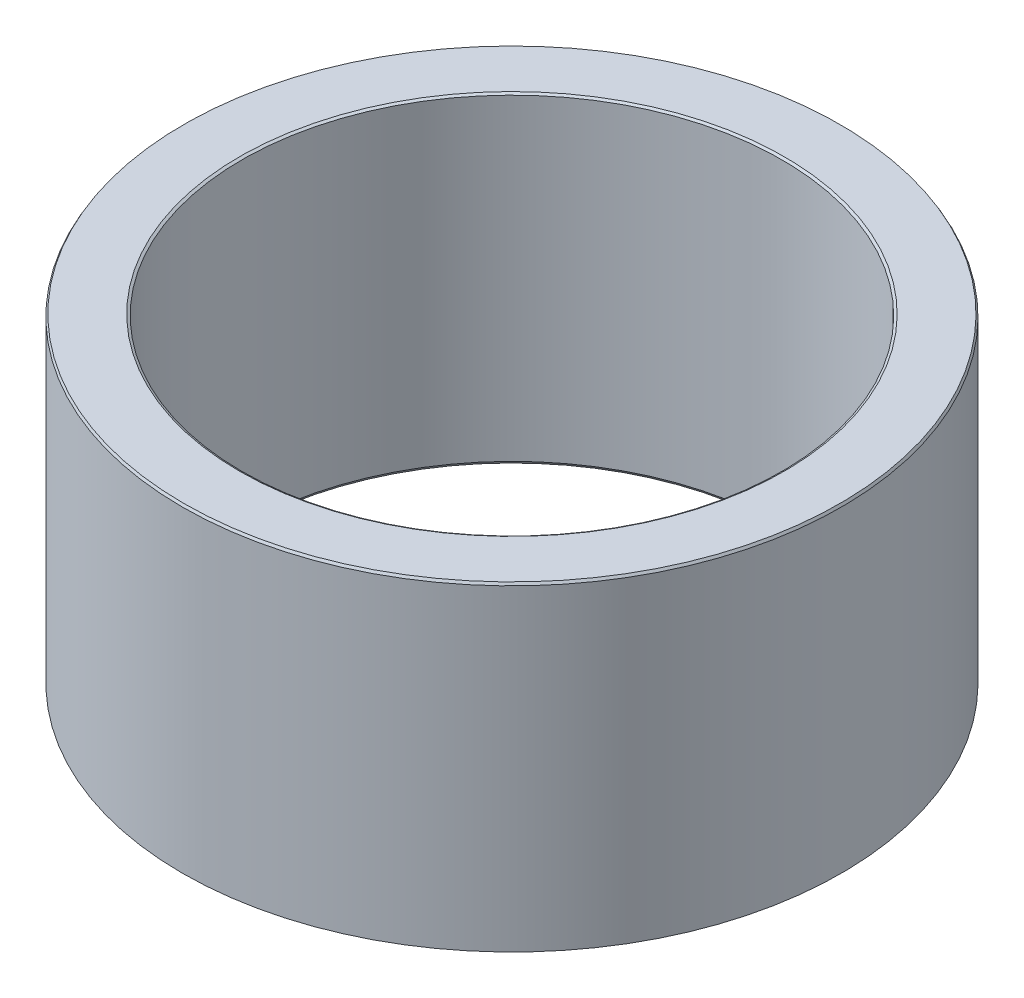
from build123d import *
from OCP.BRepFilletAPI import BRepFilletAPI_MakeChamfer

# Parameters (mm, degrees)
SKETCH1_R           = 30
BOSS_EXTRUDE1_DEPTH = 29.217297284
SKETCH2_R           = 24.57467047
CUT_EXTRUDE1_DEPTH  = 52.51359491
CHAMFER1_SIZE       = 0.221164884
CHAMFER1_SIZE2      = 0.127689605


with BuildPart() as part:
    # Sketch1 → Boss-Extrude1 (new body)
    with BuildSketch(Plane(origin=(0, 0, 0), x_dir=(1, 0, 0), z_dir=(0, 1, 0))):
        Circle(SKETCH1_R)
    extrude(amount=BOSS_EXTRUDE1_DEPTH)

    # Sketch2 → Cut-Extrude1 (cut, through all)
    with BuildSketch(Plane(origin=(0, 0, 0), x_dir=(1, 0, 0), z_dir=(0, 1, 0))):
        Circle(SKETCH2_R)
    extrude(amount=CUT_EXTRUDE1_DEPTH, mode=Mode.SUBTRACT)

    # Chamfer1: one chamfer whose edges measure the first distance from different faces: ONE call of the kernel's chamfer builder (chamfer() names one face for all edges)
    chamfer1_edges_1 = [part.edges().sort_by_distance(p)[0] for p in [
        (-24.57467047, 29.217297284, 0),
    ]]
    chamfer1_side_1 = [part.faces().sort_by_distance(p)[0] for p in [
        (-29.151471863, 29.217297284, 0),
    ]]
    chamfer1_edges_2 = [part.edges().sort_by_distance(p)[0] for p in [
        (-24.57467047, 0, 0),
    ]]
    chamfer1_side_2 = [part.faces().sort_by_distance(p)[0] for p in [
        (-24.57467047, 14.608648642, 0),
    ]]
    chamfer1_edges_3 = [part.edges().sort_by_distance(p)[0] for p in [
        (-30, 0, 0),
    ]]
    chamfer1_side_3 = [part.faces().sort_by_distance(p)[0] for p in [
        (-29.151471863, 0, 0),
    ]]
    chamfer1_edges_4 = [part.edges().sort_by_distance(p)[0] for p in [
        (-30, 29.217297284, 0),
    ]]
    chamfer1_side_4 = [part.faces().sort_by_distance(p)[0] for p in [
        (-30, 14.608648642, 0),
    ]]
    chamfer1 = BRepFilletAPI_MakeChamfer(part.part.solid().wrapped)
    for e in chamfer1_edges_1:
        chamfer1.Add(CHAMFER1_SIZE, CHAMFER1_SIZE2, e.wrapped, chamfer1_side_1[0].wrapped)  # the first distance lies on this face
    for e in chamfer1_edges_2:
        chamfer1.Add(CHAMFER1_SIZE, CHAMFER1_SIZE2, e.wrapped, chamfer1_side_2[0].wrapped)  # the first distance lies on this face
    for e in chamfer1_edges_3:
        chamfer1.Add(CHAMFER1_SIZE, CHAMFER1_SIZE2, e.wrapped, chamfer1_side_3[0].wrapped)  # the first distance lies on this face
    for e in chamfer1_edges_4:
        chamfer1.Add(CHAMFER1_SIZE, CHAMFER1_SIZE2, e.wrapped, chamfer1_side_4[0].wrapped)  # the first distance lies on this face
    add(Compound.cast(chamfer1.Shape()), mode=Mode.REPLACE)


solid = part.part
